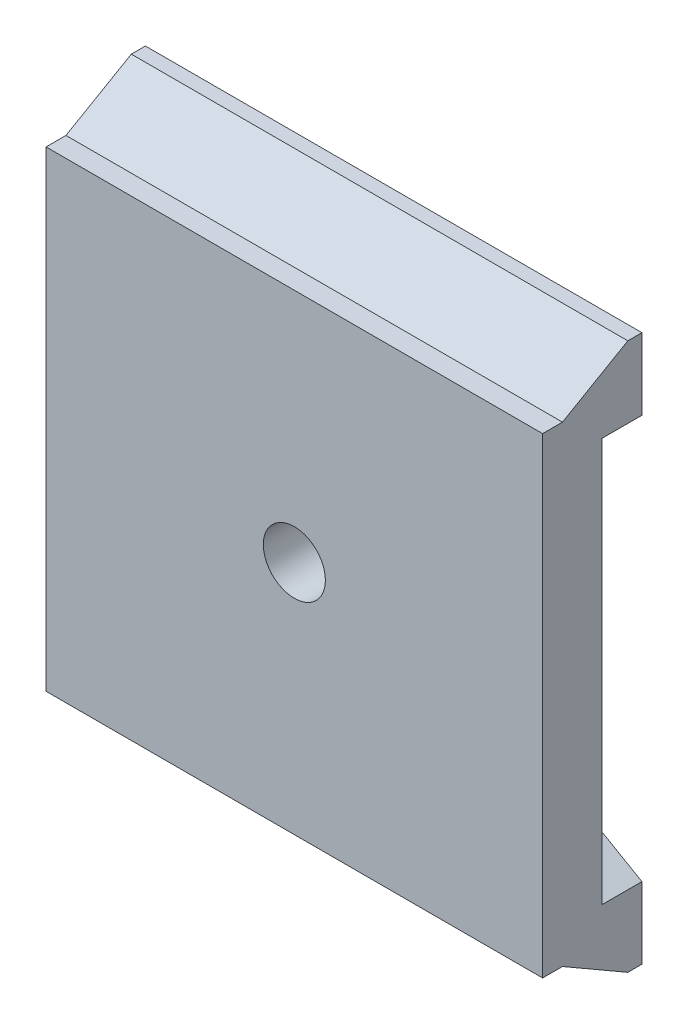
from build123d import *

# Parameters (mm, degrees)
SKETCH1_W           = 50.8
SKETCH1_H           = 55.9562
BOSS_EXTRUDE1_DEPTH = 10.16
SKETCH2_W           = 50.8
SKETCH2_H           = 3.8608
CUT_EXTRUDE1_DEPTH  = 2.032
CUT_EXTRUDE2_DEPTH  = 59.878176599
SKETCH4_R           = 3.175
CUT_EXTRUDE3_DEPTH  = 40.130035518
SKETCH5_W           = 50.8
SKETCH5_H           = 33.9852
CUT_EXTRUDE4_DEPTH  = 4.064
CUT_EXTRUDE5_DEPTH  = 4.064
CUT_EXTRUDE6_DEPTH  = 4.064


with BuildPart() as part:
    # Sketch1 → Boss-Extrude1 (new body)
    with BuildSketch(Plane.XY):
        Rectangle(SKETCH1_W, SKETCH1_H)
    extrude(amount=BOSS_EXTRUDE1_DEPTH)

    # Sketch2 → Cut-Extrude1 (cut)
    with BuildSketch(Plane.XY.offset(10.16)):
        with Locations((0, 26.0477)):
            Rectangle(SKETCH2_W, SKETCH2_H)
        with Locations((0, -26.0477)):
            Rectangle(SKETCH2_W, SKETCH2_H)
    extrude(amount=-CUT_EXTRUDE1_DEPTH, mode=Mode.SUBTRACT)

    # Sketch3 → Cut-Extrude2 (cut, through all)
    with BuildSketch(Plane.ZY.offset(25.4)):
        Polygon((8.128, 24.1173), (1.440898242, 27.9781), (8.128, 27.9781), align=None)
        Polygon((8.128, -24.1173), (1.440898242, -27.9781), (8.128, -27.9781), align=None)
    extrude(amount=-CUT_EXTRUDE2_DEPTH, mode=Mode.SUBTRACT)

    # Sketch4 → Cut-Extrude3 (cut, through all)
    with BuildSketch(Plane.XY.offset(10.16)):
        Circle(SKETCH4_R)
    extrude(amount=-CUT_EXTRUDE3_DEPTH, mode=Mode.SUBTRACT)

    # Sketch5 → Cut-Extrude4 (cut)
    with BuildSketch(Plane(origin=(0, 0, 0), x_dir=(-1, 0, 0), z_dir=(0, 0, -1))):
        Rectangle(SKETCH5_W, SKETCH5_H)
    extrude(amount=-CUT_EXTRUDE4_DEPTH, mode=Mode.SUBTRACT)

    # Sketch6 → Cut-Extrude5 (cut)
    with BuildSketch(Plane(origin=(0, 0, 0), x_dir=(-1, 0, 0), z_dir=(0, 0, -1))):
        with BuildLine():
            Line((12.7, 21.0058), (-12.7, 21.0058))
            ThreePointArc((-12.7, 21.0058), (-14.94506403, 20.07586403), (-15.875, 17.8308))
            Line((-15.875, 17.8308), (-15.875, -17.8308))
            ThreePointArc((-15.875, -17.8308), (-14.94506403, -20.07586403), (-12.7, -21.0058))
            Line((-12.7, -21.0058), (12.7, -21.0058))
            ThreePointArc((12.7, -21.0058), (14.94506403, -20.07586403), (15.875, -17.8308))
            Line((15.875, -17.8308), (15.875, 17.8308))
            ThreePointArc((15.875, 17.8308), (14.94506403, 20.07586403), (12.7, 21.0058))
        make_face()
    extrude(amount=-CUT_EXTRUDE5_DEPTH, mode=Mode.SUBTRACT)

    # Sketch7 → Cut-Extrude6 (cut)
    with BuildSketch(Plane(origin=(0, 0, 0), x_dir=(-1, 0, 0), z_dir=(0, 0, -1))):
        Polygon((-19.05, 16.9926), (-25.4, 20.658774209), (-25.4, 16.9926), align=None)
        Polygon((-19.05, -16.9926), (-25.4, -20.658774209), (-25.4, -16.9926), align=None)
        Polygon((19.05, -16.9926), (25.4, -20.658774209), (25.4, -16.9926), align=None)
        Polygon((19.05, 16.9926), (25.4, 20.658774209), (25.4, 16.9926), align=None)
    extrude(amount=-CUT_EXTRUDE6_DEPTH, mode=Mode.SUBTRACT)


solid = part.part
